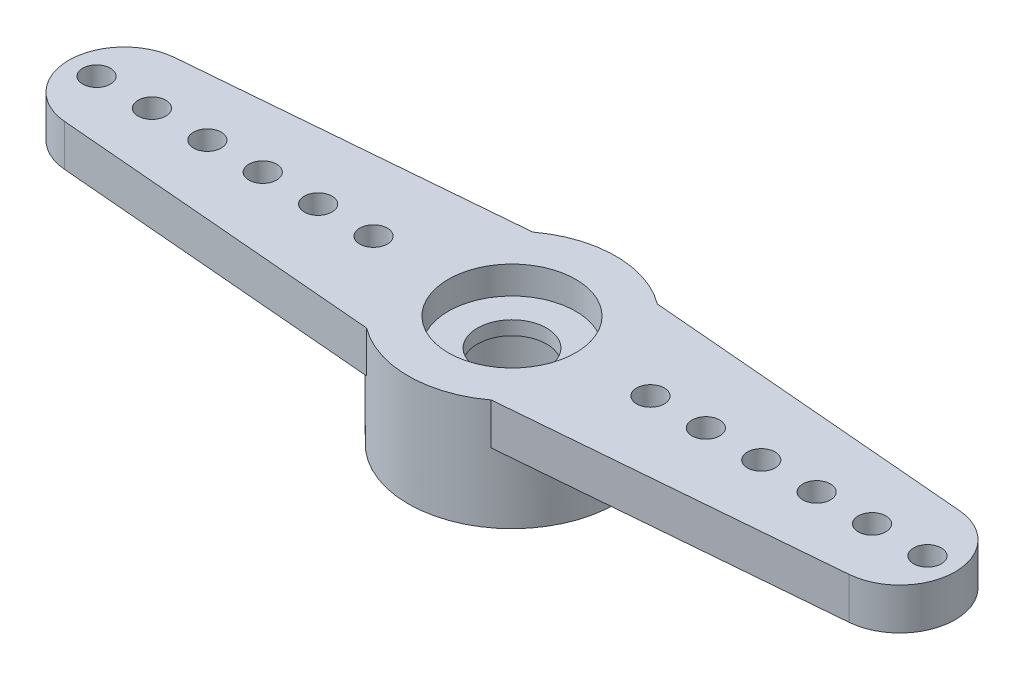
from build123d import *

# Parameters (mm, degrees)
SKETCH1_R           = 3.75
BOSS_EXTRUDE1_DEPTH = 4
SKETCH2_R           = 2.3
CUT_EXTRUDE1_DEPTH  = 1
BOSS_EXTRUDE2_START = -1.5
SKETCH3_R           = 0.5
BOSS_EXTRUDE2_DEPTH = 1.5
SKETCH4_R           = 1.25
CUT_EXTRUDE2_DEPTH  = 4.5
CUT_EXTRUDE3_START  = -2.5
SKETCH5_R           = 2.3
CUT_EXTRUDE3_DEPTH  = 2.5


with BuildPart() as part:
    # Sketch1 → Boss-Extrude1 (new body)
    with BuildSketch(Plane(origin=(0, 0, 0), x_dir=(1, 0, 0), z_dir=(0, 1, 0))):
        Circle(SKETCH1_R)
    extrude(amount=BOSS_EXTRUDE1_DEPTH)

    # Sketch2 → Cut-Extrude1 (cut)
    with BuildSketch(Plane(origin=(0, 4, 0), x_dir=(1, 0, 0), z_dir=(0, 1, 0))):
        Circle(SKETCH2_R)
    extrude(amount=-CUT_EXTRUDE1_DEPTH, mode=Mode.SUBTRACT)

    # Sketch3 → Boss-Extrude2 (add)
    # profile 1 of 2: a face of its own
    with BuildSketch(Plane(origin=(0, 4, 0), x_dir=(1, 0, 0), z_dir=(0, 1, 0)).offset(BOSS_EXTRUDE2_START)):
        with BuildLine():
            Line((-14.168399438, 1.992897797), (-2.25, 3))
            ThreePointArc((-2.25, 3), (-3.75, 0), (-2.25, -3))
            Line((-2.25, -3), (-14.168399438, -1.992897797))
            ThreePointArc((-14.168399438, -1.992897797), (-16, 0), (-14.168399438, 1.992897797))
        make_face()
        with Locations((-15, 0)):
            Circle(SKETCH3_R, mode=Mode.SUBTRACT)
        with Locations((-13, 0)):
            Circle(SKETCH3_R, mode=Mode.SUBTRACT)
        with Locations((-11, 0)):
            Circle(SKETCH3_R, mode=Mode.SUBTRACT)
        with Locations((-9, 0)):
            Circle(SKETCH3_R, mode=Mode.SUBTRACT)
        with Locations((-7, 0)):
            Circle(SKETCH3_R, mode=Mode.SUBTRACT)
        with Locations((-5, 0)):
            Circle(SKETCH3_R, mode=Mode.SUBTRACT)
    # profile 2 of 2: a face of its own
    with BuildSketch(Plane(origin=(0, 4, 0), x_dir=(1, 0, 0), z_dir=(0, 1, 0)).offset(BOSS_EXTRUDE2_START)):
        with BuildLine():
            Line((14.168399438, -1.992897797), (2.25, -3))
            ThreePointArc((2.25, -3), (3.75, 0), (2.25, 3))
            Line((2.25, 3), (14.168399438, 1.992897797))
            ThreePointArc((14.168399438, 1.992897797), (16, 0), (14.168399438, -1.992897797))
        make_face()
        with Locations((15, 0)):
            Circle(SKETCH3_R, mode=Mode.SUBTRACT)
        with Locations((5, 0)):
            Circle(SKETCH3_R, mode=Mode.SUBTRACT)
        with Locations((7, 0)):
            Circle(SKETCH3_R, mode=Mode.SUBTRACT)
        with Locations((9, 0)):
            Circle(SKETCH3_R, mode=Mode.SUBTRACT)
        with Locations((11, 0)):
            Circle(SKETCH3_R, mode=Mode.SUBTRACT)
        with Locations((13, 0)):
            Circle(SKETCH3_R, mode=Mode.SUBTRACT)
    extrude(amount=BOSS_EXTRUDE2_DEPTH)

    # Sketch4 → Cut-Extrude2 (cut)
    with BuildSketch(Plane(origin=(0, 3, 0), x_dir=(1, 0, 0), z_dir=(0, 1, 0))):
        Circle(SKETCH4_R)
    extrude(amount=-CUT_EXTRUDE2_DEPTH, mode=Mode.SUBTRACT)

    # Sketch5 → Cut-Extrude3 (cut)
    with BuildSketch(Plane.XZ.offset(CUT_EXTRUDE3_START)):
        Circle(SKETCH5_R)
    extrude(amount=CUT_EXTRUDE3_DEPTH, mode=Mode.SUBTRACT)


solid = part.part
